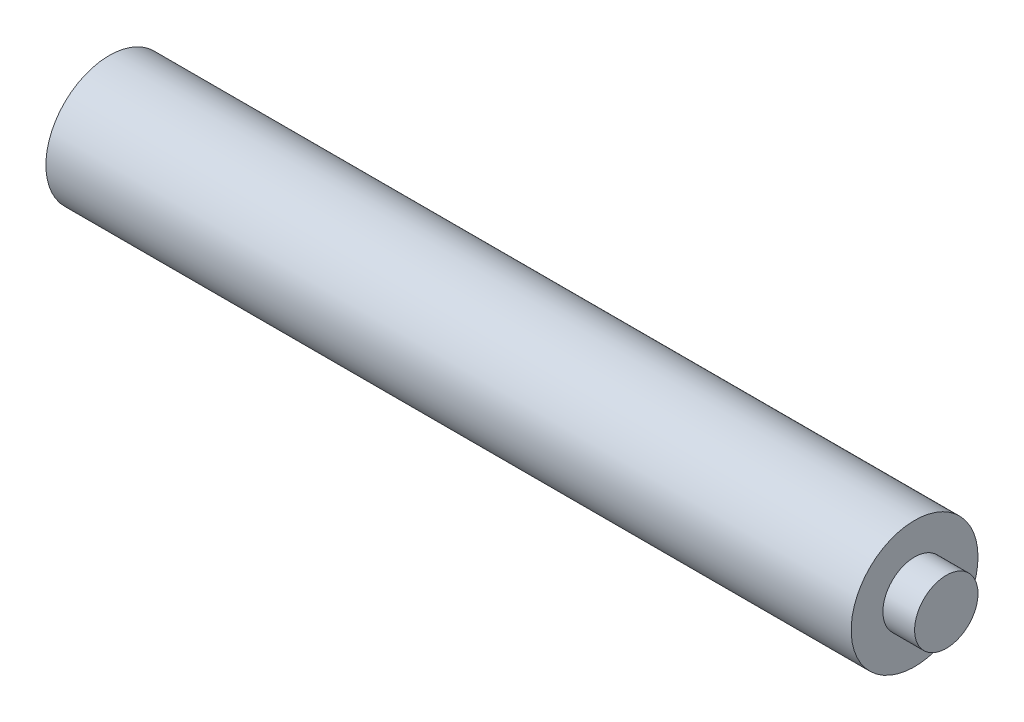
from build123d import *

# Parameters (mm, degrees)
SKETCH1_R           = 4
BOSS_EXTRUDE1_DEPTH = 25.4
SKETCH2_R           = 2
BOSS_EXTRUDE2_DEPTH = 2


with BuildPart() as part:
    # Sketch1 → Boss-Extrude1 (new, symmetric)
    with BuildSketch(Plane(origin=(0, 0, 0), x_dir=(0, 0, -1), z_dir=(1, 0, 0))):
        Circle(SKETCH1_R)
    extrude(amount=BOSS_EXTRUDE1_DEPTH, both=True)

    # Sketch2 → Boss-Extrude2 (add)
    with BuildSketch(Plane(origin=(25.4, 0, 0), x_dir=(0, 0, -1), z_dir=(1, 0, 0))):
        Circle(SKETCH2_R)
    extrude(amount=BOSS_EXTRUDE2_DEPTH)


solid = part.part
